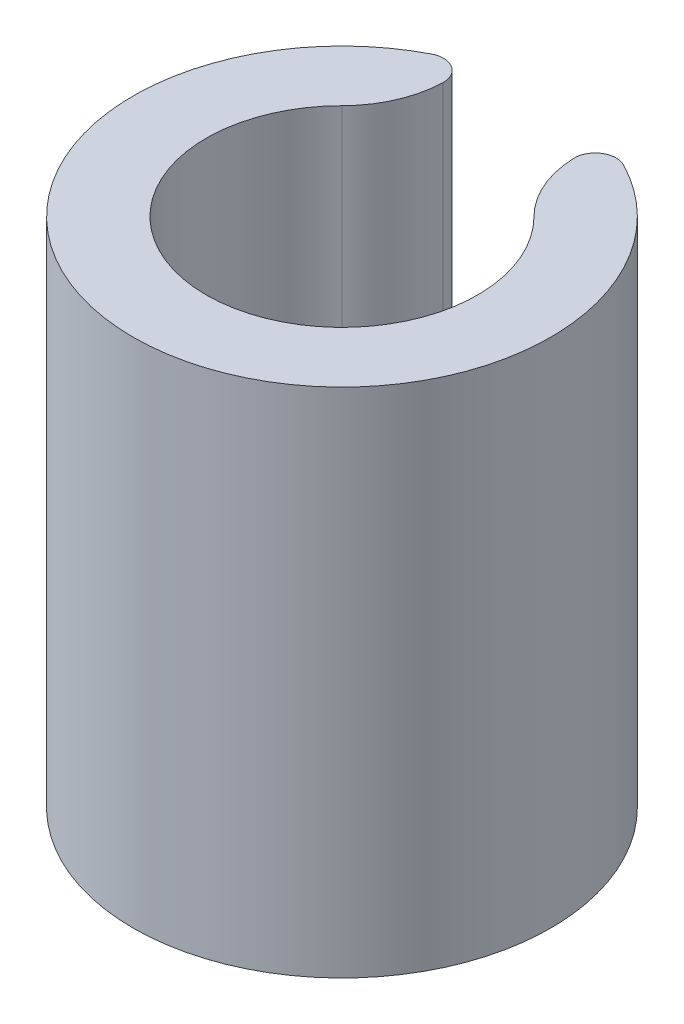
from build123d import *

# Parameters (mm, degrees)
SKETCH1_R           = 4
SKETCH1_R_2         = 2.6
BOSS_EXTRUDE1_DEPTH = 9.8
CUT_EXTRUDE1_DEPTH  = 12.315476128
FILLET1_R           = 0.4


with BuildPart() as part:
    # Sketch1 → Boss-Extrude1 (new body)
    with BuildSketch(Plane(origin=(0, 0, 0), x_dir=(1, 0, 0), z_dir=(0, 1, 0))):
        Circle(SKETCH1_R)
        Circle(SKETCH1_R_2, mode=Mode.SUBTRACT)
    extrude(amount=BOSS_EXTRUDE1_DEPTH)

    # Sketch2 → Cut-Extrude1 (cut, through all)
    with BuildSketch(Plane(origin=(0, 9.8, 0), x_dir=(1, 0, 0), z_dir=(0, 1, 0))):
        with BuildLine():
            ThreePointArc((-1.838477631, 1.838477631), (-1.320191838, 2.737476443), (-1.322144063, 3.775173516))
            ThreePointArc((-1.322144063, 3.775173516), (0, 4), (1.322144063, 3.775173516))
            ThreePointArc((1.322144063, 3.775173516), (1.320191838, 2.737476443), (1.838477631, 1.838477631))
            ThreePointArc((1.838477631, 1.838477631), (0, 2.6), (-1.838477631, 1.838477631))
        make_face()
    extrude(amount=-CUT_EXTRUDE1_DEPTH, mode=Mode.SUBTRACT)

    # Fillet1
    fillet1_edges = [part.edges().sort_by_distance(p)[0] for p in [
        (1.322144063, 4.9, -3.775173516),
        (-1.322144063, 4.9, -3.775173516),
    ]]
    fillet(fillet1_edges, radius=FILLET1_R)


solid = part.part
